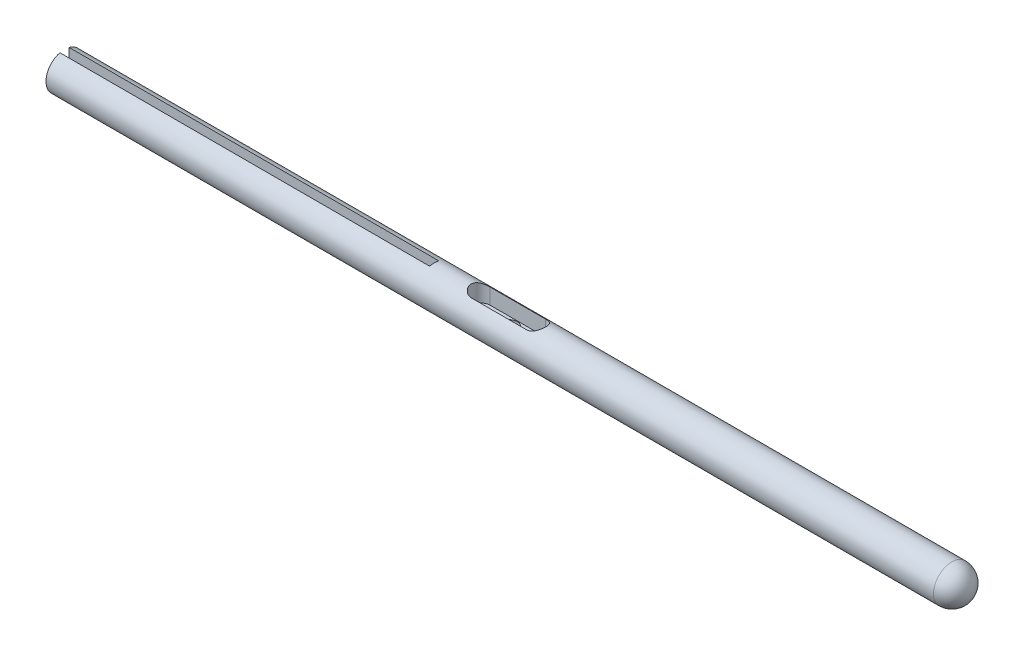
from build123d import *

# Parameters (mm, degrees)
SKETCH1_R                       = 3.175
BOSS_EXTRUDE1_DEPTH             = 152.4
SKETCH3_W                       = 1.5875
SKETCH3_H                       = 6.35
CUT_EXTRUDE1_DEPTH              = 63.5
CUT_EXTRUDE2_DEPTH              = 3.175
F_32_0_116_DIAMETER_HOLE1_D     = 2.9464
F_32_0_116_DIAMETER_HOLE1_DEPTH = 25.4
F_32_0_116_DIAMETER_HOLE1_TIP   = 0.885187864


with BuildPart() as part:
    # Sketch1 → Boss-Extrude1 (new body)
    with BuildSketch(Plane(origin=(0, 0, 0), x_dir=(0, 0, -1), z_dir=(1, 0, 0))):
        Circle(SKETCH1_R)
    extrude(amount=BOSS_EXTRUDE1_DEPTH)

    # Sketch2 → Revolve1 (revolve)
    with BuildSketch(Plane.XY):
        with BuildLine():
            Line((152.4, 3.175), (152.4, 0))
            Line((152.4, 0), (155.575, 0))
            ThreePointArc((155.575, 0), (154.64506403, 2.24506403), (152.4, 3.175))
        make_face()
    revolve(axis=Axis((152.4, 0, 0), (-1, 0, 0)))

    # Sketch3 → Cut-Extrude1 (cut)
    with BuildSketch(Plane.ZY):
        Rectangle(SKETCH3_W, SKETCH3_H)
    extrude(amount=-CUT_EXTRUDE1_DEPTH, mode=Mode.SUBTRACT)

    # Sketch4 → Cut-Extrude2 (cut)
    with BuildSketch(Plane(origin=(0, 0, 0), x_dir=(1, 0, 0), z_dir=(0, 1, 0))):
        with BuildLine():
            Line((80.9625, 1.671783879), (71.4375, 1.671783879))
            ThreePointArc((71.4375, 1.671783879), (69.803530381, 0.03781426), (71.4375, -1.596155359))
            Line((71.4375, -1.596155359), (80.9625, -1.596155359))
            ThreePointArc((80.9625, -1.596155359), (82.596469619, 0.03781426), (80.9625, 1.671783879))
        make_face()
    extrude(amount=CUT_EXTRUDE2_DEPTH, mode=Mode.SUBTRACT)

    # #32 (0.116) Diameter Hole1
    with Locations(Plane(origin=(0, 0, 0), x_dir=(-1, 0, 0), z_dir=(0, 1, 0))):
        with Locations((-76.2, -0.084283879)):
            Hole(F_32_0_116_DIAMETER_HOLE1_D / 2, depth=F_32_0_116_DIAMETER_HOLE1_DEPTH)
            with Locations((0, 0, -(F_32_0_116_DIAMETER_HOLE1_DEPTH + F_32_0_116_DIAMETER_HOLE1_TIP / 2))):  # 118° drill point
                Cone(0, F_32_0_116_DIAMETER_HOLE1_D / 2, F_32_0_116_DIAMETER_HOLE1_TIP, mode=Mode.SUBTRACT)


solid = part.part
